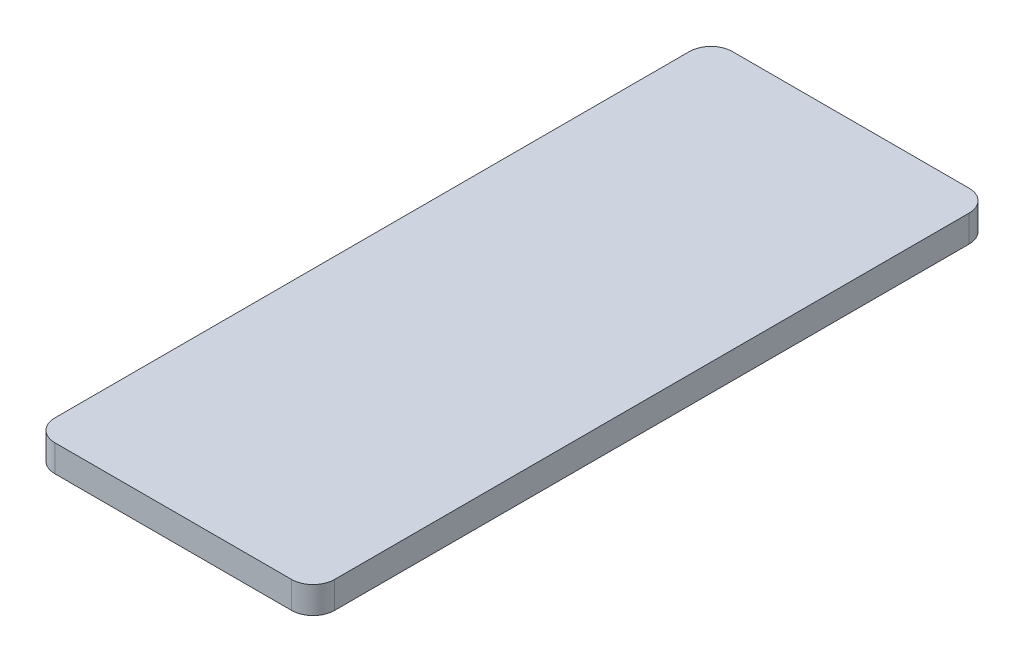
from build123d import *

# Parameters (mm, degrees)
SKETCH1_W           = 33.03
SKETCH1_H           = 80
BOSS_EXTRUDE1_DEPTH = 3.175
FILLET1_R           = 2.54


with BuildPart() as part:
    # Sketch1 → Boss-Extrude1 (new body)
    with BuildSketch(Plane(origin=(0, 0, 0), x_dir=(1, 0, 0), z_dir=(0, 1, 0))):
        with Locations((-9.766081081, 16.216216216)):
            Rectangle(SKETCH1_W, SKETCH1_H)
    extrude(amount=BOSS_EXTRUDE1_DEPTH)

    # Fillet1
    fillet1_edges = [part.edges().sort_by_distance(p)[0] for p in [
        (-26.281081081, 1.5875, -56.216216216),
        (6.748918919, 1.5875, -56.216216216),
        (6.748918919, 1.5875, 23.783783784),
        (-26.281081081, 1.5875, 23.783783784),
    ]]
    fillet(fillet1_edges, radius=FILLET1_R)


solid = part.part
